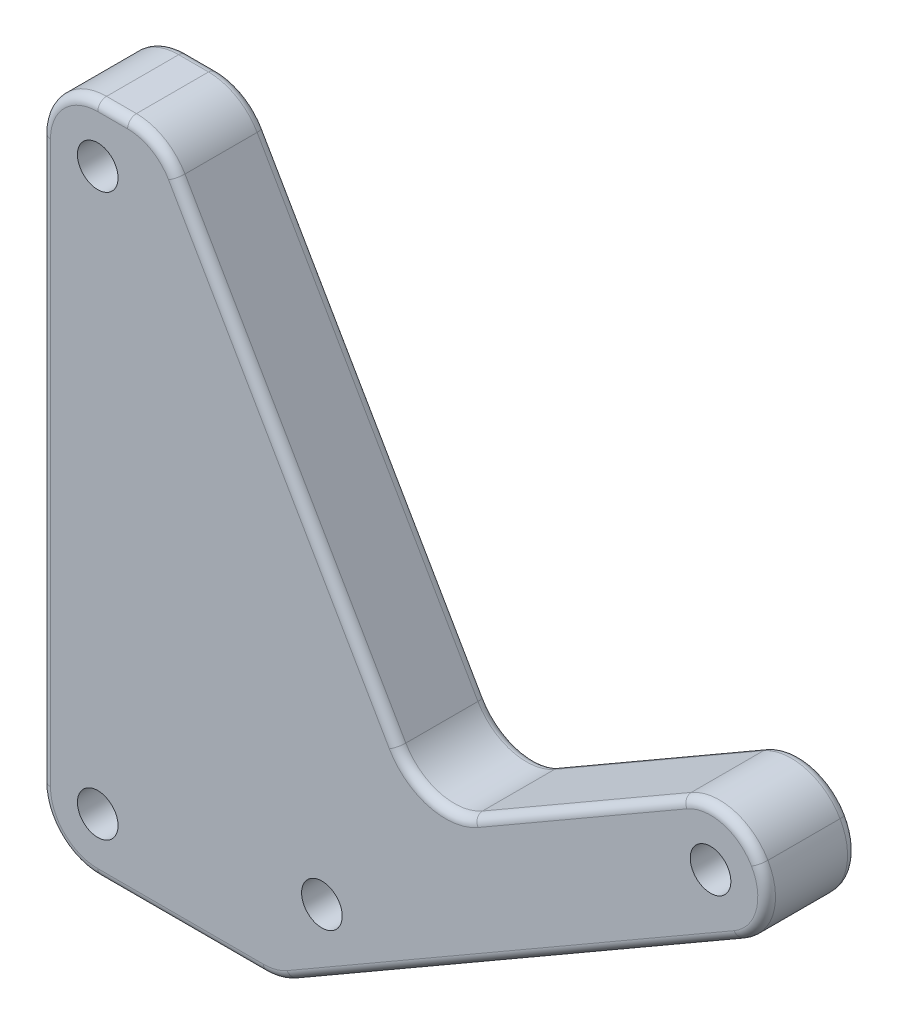
from build123d import *

# Parameters (mm, degrees)
SKETCH1_R           = 2.3
BOSS_EXTRUDE1_DEPTH = 10.16
FILLET1_R           = 6.35
FILLET3_R           = 1


with BuildPart() as part:
    # Sketch1 → Boss-Extrude1 (new body)
    with BuildSketch(Plane.XY):
        Polygon((0, 235.981834591), (-30, 287.943358818), (-43.398894252, 287.943358818), (-43.398894252, 211.743358818), (-16.582271537, 211.743358818), (40.991016151, 244.983311963), (34.641016151, 255.981834591), align=None)
        with Locations((-37.048894252, 218.093358818)):
            Circle(SKETCH1_R, mode=Mode.SUBTRACT)
        with Locations((-37.048894252, 281.593358818)):
            Circle(SKETCH1_R, mode=Mode.SUBTRACT)
        with Locations((32.316754837, 247.307573277)):
            Circle(SKETCH1_R, mode=Mode.SUBTRACT)
        with Locations((-11.677335675, 221.907573277)):
            Circle(SKETCH1_R, mode=Mode.SUBTRACT)
    extrude(amount=BOSS_EXTRUDE1_DEPTH)

    # Fillet1
    fillet1_edges = [part.edges().sort_by_distance(p)[0] for p in [
        (-30, 287.943358818, 5.08),
        (-16.582271537, 211.743358818, 5.08),
        (-43.398894252, 211.743358818, 5.08),
        (-43.398894252, 287.943358818, 5.08),
        (34.641016151, 255.981834591, 5.08),
        (40.991016151, 244.983311963, 5.08),
        (0, 235.981834591, 5.08),
    ]]
    fillet(fillet1_edges, radius=FILLET1_R - 0.0001)  # a hair under: the kernel refuses the full size

    # Fillet3
    fillet3_edges = [part.edges().sort_by_distance(p)[0] for p in [
        (-15.670945881, 263.124709061, 0),
        (-15.670945881, 263.124709061, 10.16),
        (17.320508076, 245.981834591, 0),
        (17.320508076, 245.981834591, 10.16),
        (10.191534663, 227.201223035, 0),
        (-27.666358183, 211.743358818, 0),
        (-43.398894252, 249.843358818, 0),
        (-35.357555363, 287.943358818, 0),
        (-41.539051602, 286.083516168, 0),
        (-41.539051602, 213.603201469, 0),
        (-16.640247059, 211.959726414, 0),
        (-30.491166474, 287.09263353, 0),
        (38.450423844, 245.66406162, 0),
        (33.960266494, 253.441242284, 0),
        (-35.357555363, 287.943358818, 10.16),
        (-43.398894252, 249.843358818, 10.16),
        (-27.666358183, 211.743358818, 10.16),
        (10.191534663, 227.201223035, 10.16),
        (-41.539051602, 286.083516168, 10.16),
        (-41.539051602, 213.603201469, 10.16),
        (-16.640247059, 211.959726414, 10.16),
        (-30.491166474, 287.09263353, 10.16),
        (38.450423844, 245.66406162, 10.16),
        (33.960266494, 253.441242284, 10.16),
        (0.680749657, 238.522426898, 0),
        (0.680749657, 238.522426898, 10.16),
    ]]
    fillet(fillet3_edges, radius=FILLET3_R)


solid = part.part
